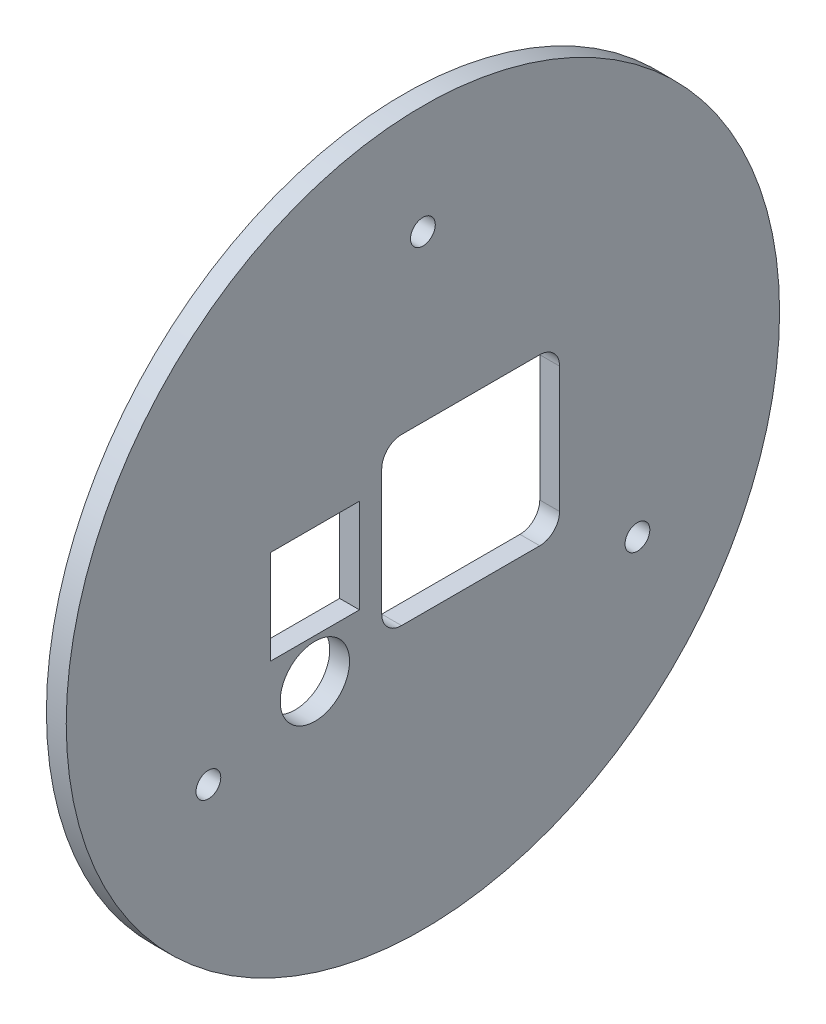
from build123d import *

# Parameters (mm, degrees)
SKETCH1_R           = 72
SKETCH1_R_2         = 7
SKETCH1_R_3         = 2.5
SKETCH1_W           = 18
SKETCH1_H           = 19
BOSS_EXTRUDE1_DEPTH = 4


with BuildPart() as part:
    # Sketch1 → Boss-Extrude1 (new body)
    with BuildSketch(Plane(origin=(0, 0, 0), x_dir=(0, 0, -1), z_dir=(1, 0, 0))):
        Circle(SKETCH1_R)
        with Locations((-21.809754717, -17.7)):
            Circle(SKETCH1_R_2, mode=Mode.SUBTRACT)
        with Locations((0, 50)):
            Circle(SKETCH1_R_3, mode=Mode.SUBTRACT)
        with Locations((43.301270189, -25)):
            Circle(SKETCH1_R_3, mode=Mode.SUBTRACT)
        with Locations((-43.301270189, -25)):
            Circle(SKETCH1_R_3, mode=Mode.SUBTRACT)
        with BuildLine():
            Line((-4.309754717, 16.7), (23.590245283, 16.7))
            ThreePointArc((23.590245283, 16.7), (26.418672408, 15.528427125), (27.590245283, 12.7))
            Line((27.590245283, 12.7), (27.590245283, -12.7))
            ThreePointArc((27.590245283, -12.7), (26.418672408, -15.528427125), (23.590245283, -16.7))
            Line((23.590245283, -16.7), (-4.309754717, -16.7))
            ThreePointArc((-4.309754717, -16.7), (-7.138181842, -15.528427125), (-8.309754717, -12.7))
            Line((-8.309754717, -12.7), (-8.309754717, 12.7))
            ThreePointArc((-8.309754717, 12.7), (-7.138181842, 15.528427125), (-4.309754717, 16.7))
        make_face(mode=Mode.SUBTRACT)
        with Locations((-21.809754717, -0.2)):
            Rectangle(SKETCH1_W, SKETCH1_H, mode=Mode.SUBTRACT)
    extrude(amount=BOSS_EXTRUDE1_DEPTH)


solid = part.part
